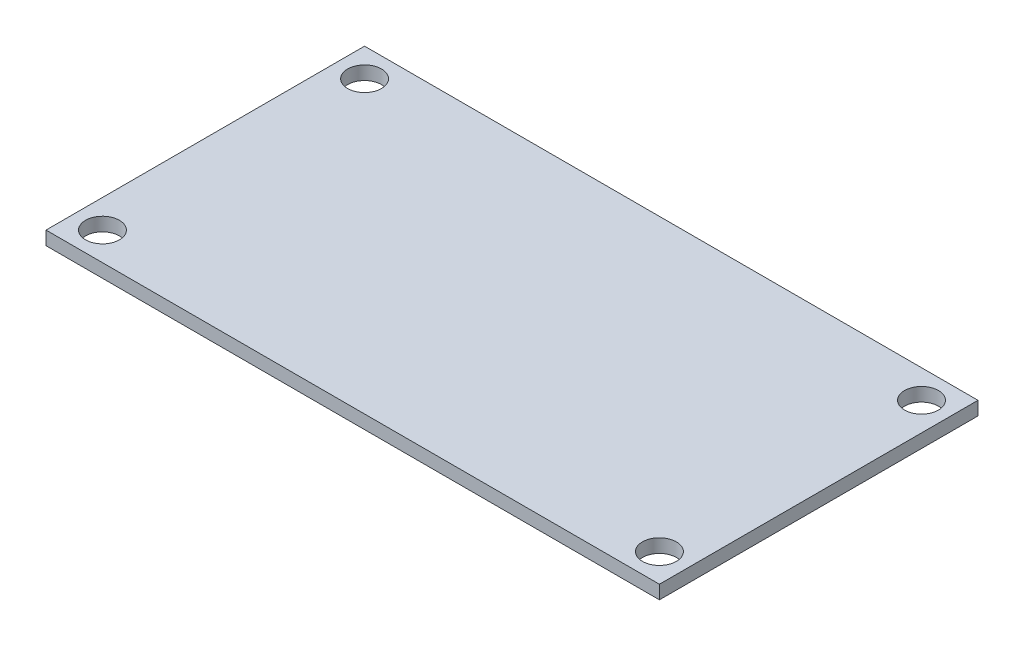
from build123d import *

# Parameters (mm, degrees)
CROQUIS1_W              = 54.3
CROQUIS1_H              = 28.2
SALIENTE_EXTRUIR1_DEPTH = 1.2
CROQUIS3_R              = 1.5
CORTAR_EXTRUIR1_DEPTH   = 1.2


with BuildPart() as part:
    # Croquis1 → Saliente-Extruir1 (new body)
    with BuildSketch(Plane(origin=(0, 0, 0), x_dir=(1, 0, 0), z_dir=(0, 1, 0))):
        Rectangle(CROQUIS1_W, CROQUIS1_H)
    extrude(amount=SALIENTE_EXTRUIR1_DEPTH)

    # Croquis3 → Cortar-Extruir1 (cut)
    with BuildSketch(Plane(origin=(0, 1.2, 0), x_dir=(1, 0, 0), z_dir=(0, 1, 0))):
        with Locations((-24.65, 11.6)):
            Circle(CROQUIS3_R)
        with Locations((24.65, 11.6)):
            Circle(CROQUIS3_R)
        with Locations((24.65, -11.6)):
            Circle(CROQUIS3_R)
        with Locations((-24.65, -11.6)):
            Circle(CROQUIS3_R)
    extrude(amount=-CORTAR_EXTRUIR1_DEPTH, mode=Mode.SUBTRACT)


solid = part.part
